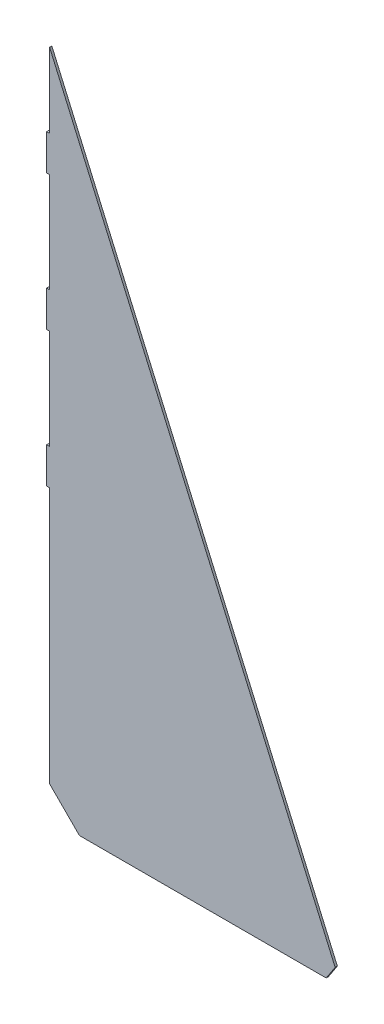
from build123d import *

# Parameters (mm, degrees)
BOSS_EXTRUDE1_DEPTH = 1.5
SKETCH7_W           = 1.5
SKETCH7_H           = 24
BOSS_EXTRUDE3_DEPTH = 2


with BuildPart() as part:
    # Sketch1 → Boss-Extrude1 (new body)
    with BuildSketch(Plane.XY):
        Polygon((0, 0), (0, 297.863160558), (191.503199705, -140.835151613), (185.5038939, -150), (20, -150), (0, -130), align=None)
    extrude(amount=BOSS_EXTRUDE1_DEPTH)

    # Sketch7 → Boss-Extrude3 (add)
    with BuildSketch(Plane.ZY):
        with Locations((0.75, 235.863160558)):
            Rectangle(SKETCH7_W, SKETCH7_H)
        with Locations((0.75, 144.983352075)):
            Rectangle(SKETCH7_W, SKETCH7_H)
        with Locations((0.75, 53.983352075)):
            Rectangle(SKETCH7_W, SKETCH7_H)
    extrude(amount=BOSS_EXTRUDE3_DEPTH)


solid = part.part
